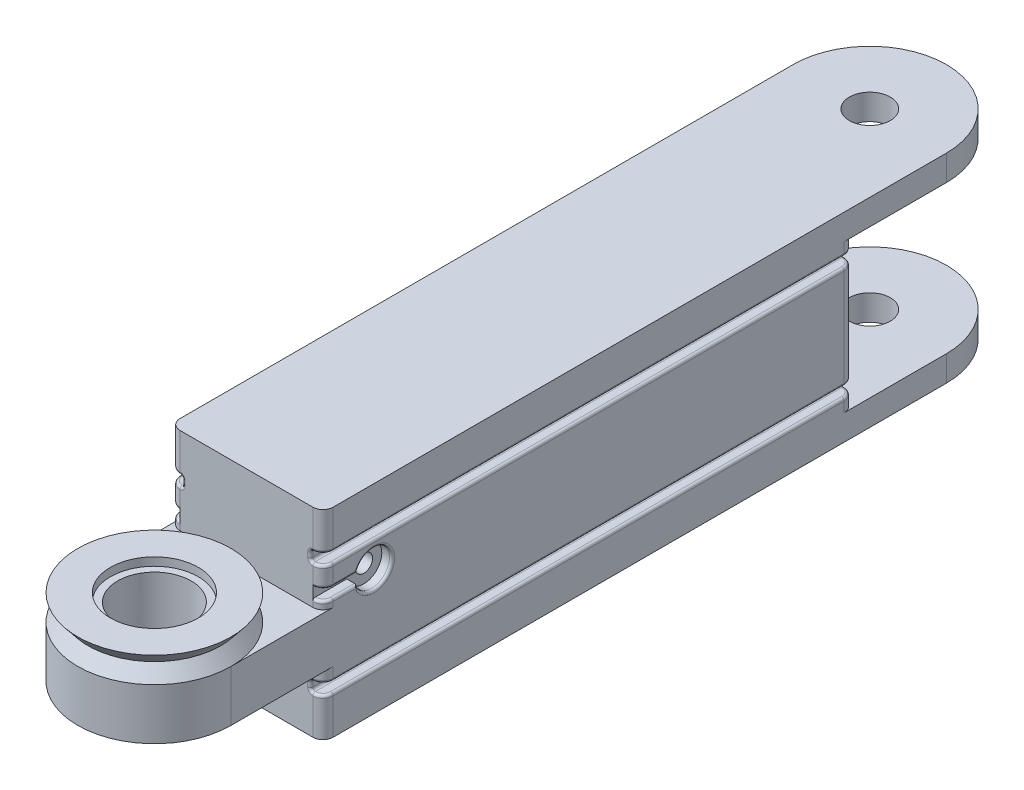
from build123d import *

# Parameters (mm, degrees)
EXTRUDE_1_DEPTH          = 5
EXTRUDE_3_DEPTH          = 8.5
EXTRUDE_3_DEPTH_BACK     = 11
CUT_EXTRUDE_1_DEPTH      = 11
CUT_EXTRUDE_1_DEPTH_BACK = 3.5
FILLET_1_R               = 1
SKETCH_5_W               = 1
SKETCH_5_H               = 1
CUT_EXTRUDE_2_DEPTH      = 5
CUT_EXTRUDE_3_REACH      = 82.084
SKETCH_6_R               = 0.5
SKETCH_7_R               = 1.75
CUT_EXTRUDE_4_DEPTH      = 1
CUT_EXTRUDE_START        = -1
SKETCH_8_R               = 1.75
CUT_EXTRUDE_5_DEPTH      = 1
CUT_EXTRUDE_6_REACH      = 72.219
SKETCH_9_W               = 1.25
SKETCH_9_H               = 1
FILLET_2_R               = 0.25
SKETCH_10_R              = 3.6
CUT_EXTRUDE_7_DEPTH      = 7.5
CUT_EXTRUDE_8_REACH      = 82.267
SKETCH_11_R              = 2
SKETCH_12_R              = 4.3
CUT_EXTRUDE_9_DEPTH      = 0.8
CUT_EXTRUDE_START_2      = -0.8
SKETCH_13_R              = 4.3
CUT_EXTRUDE_10_DEPTH     = 0.8
SKETCH_14_R              = 0.85
CUT_EXTRUDE_11_DEPTH     = 13


with BuildPart() as part:
    # 스케치1 → 보스-돌출1 (new body)
    with BuildSketch(Plane(origin=(0, 0, 0), x_dir=(1, 0, 0), z_dir=(0, 1, 0))):
        with BuildLine():
            Line((-7.5, 0), (-7.5, 70))
            ThreePointArc((-7.5, 70), (0, 77.5), (7.5, 70))
            Line((7.5, 70), (7.5, 0))
            ThreePointArc((7.5, 0), (0, -7.5), (-7.5, 0))
        make_face()
    extrude(amount=EXTRUDE_1_DEPTH)

    # 스케치2 → 회전1 (revolve)
    with BuildSketch(Plane.XY, mode=Mode.PRIVATE) as revolve_1_sk:
        Polygon((-6.5, 6.25), (-7.5, 5), (0, 5), (0, 7.5), (-7.5, 7.5), align=None)
    revolve(revolve_1_sk.sketch.rotate(Axis((0, 0, 0), (0, 1, 0)), 270), axis=Axis((0, 0, 0), (0, 1, 0)))

    # 스케치3 → 보스-돌출3 (add, two sides: drawn at the far end of the back side and taken through both)
    with BuildSketch(Plane(origin=(0, 5, 0), x_dir=(1, 0, 0), z_dir=(0, 1, 0)).offset(-EXTRUDE_3_DEPTH_BACK)):
        with BuildLine():
            Line((7.5, 70), (7.5, 9))
            Line((7.5, 9), (-7.5, 9))
            Line((-7.5, 9), (-7.5, 70))
            ThreePointArc((-7.5, 70), (0, 77.5), (7.5, 70))
        make_face()
    extrude(amount=EXTRUDE_3_DEPTH + EXTRUDE_3_DEPTH_BACK)

    # 스케치4 → 컷-돌출1 (cut, two sides: drawn at the far end of the back side and taken through both)
    with BuildSketch(Plane(origin=(0, 0, 0), x_dir=(1, 0, 0), z_dir=(0, 1, 0)).offset(-CUT_EXTRUDE_1_DEPTH_BACK)):
        with BuildLine():
            Line((7.5, 70), (7.5, 61))
            Line((7.5, 61), (-7.5, 61))
            Line((-7.5, 61), (-7.5, 70))
            ThreePointArc((-7.5, 70), (0, 77.5), (7.5, 70))
        make_face()
    extrude(amount=CUT_EXTRUDE_1_DEPTH + CUT_EXTRUDE_1_DEPTH_BACK, mode=Mode.SUBTRACT)

    # 필렛1
    fillet_1_edges = [part.edges().sort_by_distance(p)[0] for p in [
        (7.5, -3, -9),
        (-7.5, -3, -9),
        (7.5, 9.25, -9),
        (-7.5, 9.25, -9),
        (-7.5, 3.75, -61),
        (7.5, 3.75, -61),
    ]]
    fillet(fillet_1_edges, radius=FILLET_1_R)

    # 스케치5 → 컷-돌출2 (cut)
    with BuildSketch(Plane.XY.offset(-9)):
        with Locations((7, 6.25)):
            Rectangle(SKETCH_5_W, SKETCH_5_H)
        with Locations((-7, 6.25)):
            Rectangle(SKETCH_5_W, SKETCH_5_H)
    extrude(amount=-CUT_EXTRUDE_2_DEPTH, mode=Mode.SUBTRACT)

    # 컷-돌출3: up to this face of the body (flat: up to its plane)
    cut_extrude_3_end = Plane(part.part.faces().sort_by_distance((-7.5, 3.682306256, -35.085901027))[0])
    # 스케치6 → 컷-돌출3 (cut, up to the picked face)
    with BuildSketch(Plane(origin=(7.5, 0, 0), x_dir=(0, 0, -1), z_dir=(1, 0, 0)), mode=Mode.PRIVATE) as cut_extrude_3_sk1:
        with Locations(Location((14, 6.25, 0), (0, 0, 90))):
            Circle(SKETCH_6_R)
    cut_extrude_3_tool1 = split(extrude(cut_extrude_3_sk1.sketch, amount=-CUT_EXTRUDE_3_REACH, mode=Mode.PRIVATE), bisect_by=cut_extrude_3_end, keep=Keep.BOTH, mode=Mode.PRIVATE)
    add(cut_extrude_3_tool1.solids().sort_by(Axis((7.5, 6.25, -14), (-1, 0, 0)))[0], mode=Mode.SUBTRACT)

    # 스케치7 → 컷-돌출4 (cut)
    with BuildSketch(Plane(origin=(7.5, 0, 0), x_dir=(0, 0, -1), z_dir=(1, 0, 0))):
        with Locations((14, 6.25)):
            Circle(SKETCH_7_R)
    extrude(amount=-CUT_EXTRUDE_4_DEPTH, mode=Mode.SUBTRACT)

    # 스케치8 → 컷-돌출5 (cut)
    with BuildSketch(Plane.ZY.offset(7.5).offset(CUT_EXTRUDE_START)):
        with Locations((-14, 6.25)):
            Circle(SKETCH_8_R)
    extrude(amount=CUT_EXTRUDE_5_DEPTH, mode=Mode.SUBTRACT)

    # 컷-돌출6: up to this face of the body (flat: up to its plane)
    cut_extrude_6_end = Plane(part.part.faces().sort_by_distance((0, 3.75, -61))[0])
    # 스케치9 → 컷-돌출6 (cut, up to the picked face)
    with BuildSketch(Plane.XY.offset(-9), mode=Mode.PRIVATE) as cut_extrude_6_sk1:
        with Locations((-6.875, 9.25)):
            Rectangle(SKETCH_9_W, SKETCH_9_H)
    cut_extrude_6_tool1 = split(extrude(cut_extrude_6_sk1.sketch, amount=-CUT_EXTRUDE_6_REACH, mode=Mode.PRIVATE), bisect_by=cut_extrude_6_end, keep=Keep.BOTH, mode=Mode.PRIVATE)
    # 스케치9 → 컷-돌출6 (cut, up to the picked face)
    with BuildSketch(Plane.XY.offset(-9), mode=Mode.PRIVATE) as cut_extrude_6_sk2:
        with Locations((6.875, 9.25)):
            Rectangle(SKETCH_9_W, SKETCH_9_H)
    cut_extrude_6_tool2 = split(extrude(cut_extrude_6_sk2.sketch, amount=-CUT_EXTRUDE_6_REACH, mode=Mode.PRIVATE), bisect_by=cut_extrude_6_end, keep=Keep.BOTH, mode=Mode.PRIVATE)
    # 스케치9 → 컷-돌출6 (cut, up to the picked face)
    with BuildSketch(Plane.XY.offset(-9), mode=Mode.PRIVATE) as cut_extrude_6_sk3:
        with Locations((6.875, -1.75)):
            Rectangle(SKETCH_9_W, SKETCH_9_H)
    cut_extrude_6_tool3 = split(extrude(cut_extrude_6_sk3.sketch, amount=-CUT_EXTRUDE_6_REACH, mode=Mode.PRIVATE), bisect_by=cut_extrude_6_end, keep=Keep.BOTH, mode=Mode.PRIVATE)
    # 스케치9 → 컷-돌출6 (cut, up to the picked face)
    with BuildSketch(Plane.XY.offset(-9), mode=Mode.PRIVATE) as cut_extrude_6_sk4:
        with Locations((-6.875, -1.75)):
            Rectangle(SKETCH_9_W, SKETCH_9_H)
    cut_extrude_6_tool4 = split(extrude(cut_extrude_6_sk4.sketch, amount=-CUT_EXTRUDE_6_REACH, mode=Mode.PRIVATE), bisect_by=cut_extrude_6_end, keep=Keep.BOTH, mode=Mode.PRIVATE)
    add(cut_extrude_6_tool1.solids().sort_by(Axis((-6.875, 9.25, -9), (0, 0, -1)))[0], mode=Mode.SUBTRACT)
    add(cut_extrude_6_tool2.solids().sort_by(Axis((6.875, 9.25, -9), (0, 0, -1)))[0], mode=Mode.SUBTRACT)
    add(cut_extrude_6_tool3.solids().sort_by(Axis((6.875, -1.75, -9), (0, 0, -1)))[0], mode=Mode.SUBTRACT)
    add(cut_extrude_6_tool4.solids().sort_by(Axis((-6.875, -1.75, -9), (0, 0, -1)))[0], mode=Mode.SUBTRACT)

    # 필렛2
    fillet_2_edges = [part.edges().sort_by_distance(p)[0] for p in [
        (7.207106781, 9.75, -60.707106781),
        (7.207106781, 9.75, -9.292893219),
        (7.207106781, 8.75, -60.707106781),
        (7.207106781, 8.75, -9.292893219),
        (7.207106781, 6.75, -9.292893219),
        (7.207106781, 5.75, -9.292893219),
        (7.207106781, -1.25, -60.707106781),
        (7.207106781, -1.25, -9.292893219),
        (7.207106781, -2.25, -60.707106781),
        (7.207106781, -2.25, -9.292893219),
        (-7.207106781, 5.75, -9.292893219),
        (-7.207106781, 6.75, -9.292893219),
        (-7.207106781, 8.75, -60.707106781),
        (-7.207106781, 8.75, -9.292893219),
        (-7.207106781, 9.75, -60.707106781),
        (-7.207106781, 9.75, -9.292893219),
        (-7.207106781, -2.25, -60.707106781),
        (-7.207106781, -2.25, -9.292893219),
        (-7.207106781, -1.25, -60.707106781),
        (-7.207106781, -1.25, -9.292893219),
        (7.5, 9.75, -35),
        (7.5, 8.75, -35),
        (7.5, 6.25, -15.75),
        (7.5, 6.75, -11.161474508),
        (7.5, 5.75, -11.161474508),
        (7.5, -1.25, -35),
        (7.5, -2.25, -35),
        (-7.5, 6.25, -15.75),
        (-7.5, 5.75, -11.161474508),
        (-7.5, 6.75, -11.161474508),
        (-7.5, 8.75, -35),
        (-7.5, 9.75, -35),
        (-7.5, -2.25, -35),
        (-7.5, -1.25, -35),
        (-6.25, 9.25, -61),
        (-6.25, 9.25, -9),
        (-6.25, -1.75, -61),
        (-6.25, -1.75, -9),
        (-6.25, 8.75, -35),
        (-6.25, -2.25, -35),
        (6.25, 9.25, -61),
        (6.25, 9.25, -9),
        (6.25, -1.75, -61),
        (6.25, -1.75, -9),
        (6.25, -1.25, -35),
        (6.25, 9.75, -35),
        (-6.25, 9.75, -35),
        (-6.25, -1.25, -35),
        (6.25, -2.25, -35),
        (6.25, 8.75, -35),
    ]]
    fillet(fillet_2_edges, radius=FILLET_2_R - 0.0001)  # a hair under: the kernel refuses the full size

    # 스케치10 → 컷-돌출7 (cut)
    with BuildSketch(Plane(origin=(0, 7.5, 0), x_dir=(1, 0, 0), z_dir=(0, 1, 0))):
        with Locations(Location((0, 0, 0), (0, 0, 270))):
            Circle(SKETCH_10_R)
    extrude(amount=-CUT_EXTRUDE_7_DEPTH, mode=Mode.SUBTRACT)

    # 컷-돌출8: up to this face of the body (flat: up to its plane)
    cut_extrude_8_end = Plane(part.part.faces().sort_by_distance((0, 13.5, -42.480415366))[0])
    # 스케치11 → 컷-돌출8 (cut, up to the picked face)
    with BuildSketch(Plane.XZ.offset(6), mode=Mode.PRIVATE) as cut_extrude_8_sk1:
        with Locations(Location((0, -70, 0), (0, 0, 270))):
            Circle(SKETCH_11_R)
    cut_extrude_8_tool1 = split(extrude(cut_extrude_8_sk1.sketch, amount=-CUT_EXTRUDE_8_REACH, mode=Mode.PRIVATE), bisect_by=cut_extrude_8_end, keep=Keep.BOTH, mode=Mode.PRIVATE)
    add(cut_extrude_8_tool1.solids().sort_by(Axis((0, -6, -70), (0, 1, 0)))[0], mode=Mode.SUBTRACT)

    # 스케치12 → 컷-돌출9 (cut)
    with BuildSketch(Plane.XZ):
        with Locations(Location((0, 0, 0), (0, 0, 270))):
            Circle(SKETCH_12_R)
    extrude(amount=-CUT_EXTRUDE_9_DEPTH, mode=Mode.SUBTRACT)

    # 스케치13 → 컷-돌출10 (cut)
    with BuildSketch(Plane(origin=(0, 7.5, 0), x_dir=(1, 0, 0), z_dir=(0, 1, 0)).offset(CUT_EXTRUDE_START_2)):
        with Locations(Location((0, 0, 0), (0, 0, 90))):
            Circle(SKETCH_13_R)
    extrude(amount=CUT_EXTRUDE_10_DEPTH, mode=Mode.SUBTRACT)

    # 스케치14 → 컷-돌출11 (cut)
    with BuildSketch(Plane(origin=(6.5, 0, 0), x_dir=(0, 0, -1), z_dir=(1, 0, 0))):
        with Locations((14, 6.25)):
            Circle(SKETCH_14_R)
    extrude(amount=-CUT_EXTRUDE_11_DEPTH, mode=Mode.SUBTRACT)


solid = part.part
